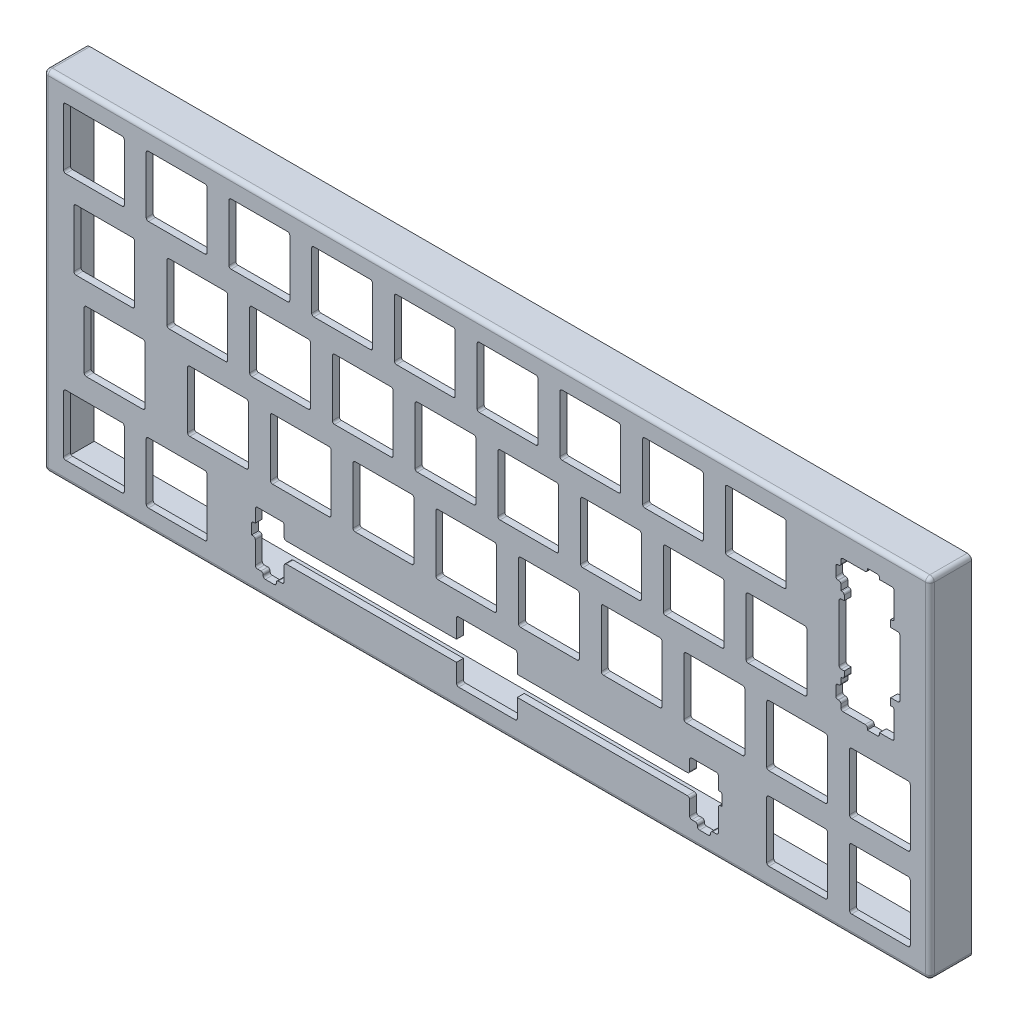
from build123d import *

# Parameters (mm, degrees)
BOSS_EXTRUDE1_OUTLINE_W = 200.025
BOSS_EXTRUDE1_OUTLINE_H = 76.2
BOSS_EXTRUDE1_DEPTH     = 1.6
SKETCH2_W               = 204.025
SKETCH2_H               = 80.2
SKETCH2_W_2             = 200.025
SKETCH2_H_2             = 76.2
BOSS_EXTRUDE2_DEPTH     = 9.6
FILLET1_R               = 1
FILLET2_R               = 1


# Read off the part's stored shape, not the designer's step: Boss-Extrude1
with BuildPart() as part:
    # Boss-Extrude1 outline → Boss-Extrude1 (new body)
    with BuildSketch(Plane.XY):
        with Locations((100.0125, 38.1)):
            Rectangle(BOSS_EXTRUDE1_OUTLINE_W, BOSS_EXTRUDE1_OUTLINE_H)
        with BuildLine():
            Line((16.525, 16.025), (16.525, 3.025))
            ThreePointArc((16.525, 3.025), (16.378553391, 2.671446609), (16.025, 2.525))
            Line((16.025, 2.525), (3.025, 2.525))
            ThreePointArc((3.025, 2.525), (2.671446609, 2.671446609), (2.525, 3.025))
            Line((2.525, 3.025), (2.525, 16.025))
            ThreePointArc((2.525, 16.025), (2.671446609, 16.378553391), (3.025, 16.525))
            Line((3.025, 16.525), (16.025, 16.525))
            ThreePointArc((16.025, 16.525), (16.378553391, 16.378553391), (16.525, 16.025))
        make_face(mode=Mode.SUBTRACT)
        with BuildLine():
            Line((35.575, 16.025), (35.575, 3.025))
            ThreePointArc((35.575, 3.025), (35.428553391, 2.671446609), (35.075, 2.525))
            Line((35.075, 2.525), (22.075, 2.525))
            ThreePointArc((22.075, 2.525), (21.721446609, 2.671446609), (21.575, 3.025))
            Line((21.575, 3.025), (21.575, 16.025))
            ThreePointArc((21.575, 16.025), (21.721446609, 16.378553391), (22.075, 16.525))
            Line((22.075, 16.525), (35.075, 16.525))
            ThreePointArc((35.075, 16.525), (35.428553391, 16.378553391), (35.575, 16.025))
        make_face(mode=Mode.SUBTRACT)
        with BuildLine():
            Line((147.1851, 15.2146), (152.8399, 15.2146))
            ThreePointArc((152.8399, 15.2146), (153.193453391, 15.068153391), (153.3399, 14.7146))
            Line((153.3399, 14.7146), (153.3399, 11.811))
            Line((153.3399, 11.811), (153.7035, 11.811))
            ThreePointArc((153.7035, 11.811), (154.057053391, 11.664553391), (154.2035, 11.311))
            Line((154.2035, 11.311), (154.2035, 9.017))
            Line((154.2035, 9.017), (153.8399, 9.017))
            ThreePointArc((153.8399, 9.017), (153.486346609, 8.870553391), (153.3399, 8.517))
            Line((153.3399, 8.517), (153.3399, 3.421))
            ThreePointArc((153.3399, 3.421), (153.193453391, 3.067446609), (152.8399, 2.921))
            Line((152.8399, 2.921), (152.0365, 2.921))
            ThreePointArc((152.0365, 2.921), (151.682946609, 2.774553391), (151.5365, 2.421))
            Line((151.5365, 2.421), (151.5365, 2.2526))
            ThreePointArc((151.5365, 2.2526), (151.390053391, 1.899046609), (151.0365, 1.7526))
            Line((151.0365, 1.7526), (148.9885, 1.7526))
            ThreePointArc((148.9885, 1.7526), (148.634946609, 1.899046609), (148.4885, 2.2526))
            Line((148.4885, 2.2526), (148.4885, 2.421))
            ThreePointArc((148.4885, 2.421), (148.342053391, 2.774553391), (147.9885, 2.921))
            Line((147.9885, 2.921), (147.1851, 2.921))
            ThreePointArc((147.1851, 2.921), (146.831546609, 3.067446609), (146.6851, 3.421))
            Line((146.6851, 3.421), (146.6851, 6.725))
            ThreePointArc((146.6851, 6.725), (146.538653391, 7.078553391), (146.1851, 7.225))
            Line((146.1851, 7.225), (107.0125, 7.225))
            Line((107.0125, 7.225), (107.0125, 3.025))
            ThreePointArc((107.0125, 3.025), (106.866053391, 2.671446609), (106.5125, 2.525))
            Line((106.5125, 2.525), (93.5125, 2.525))
            ThreePointArc((93.5125, 2.525), (93.158946609, 2.671446609), (93.0125, 3.025))
            Line((93.0125, 3.025), (93.0125, 7.225))
            Line((93.0125, 7.225), (53.8399, 7.225))
            ThreePointArc((53.8399, 7.225), (53.486346609, 7.078553391), (53.3399, 6.725))
            Line((53.3399, 6.725), (53.3399, 3.421))
            ThreePointArc((53.3399, 3.421), (53.193453391, 3.067446609), (52.8399, 2.921))
            Line((52.8399, 2.921), (52.0365, 2.921))
            ThreePointArc((52.0365, 2.921), (51.682946609, 2.774553391), (51.5365, 2.421))
            Line((51.5365, 2.421), (51.5365, 2.2526))
            ThreePointArc((51.5365, 2.2526), (51.390053391, 1.899046609), (51.0365, 1.7526))
            Line((51.0365, 1.7526), (48.9885, 1.7526))
            ThreePointArc((48.9885, 1.7526), (48.634946609, 1.899046609), (48.4885, 2.2526))
            Line((48.4885, 2.2526), (48.4885, 2.421))
            ThreePointArc((48.4885, 2.421), (48.342053391, 2.774553391), (47.9885, 2.921))
            Line((47.9885, 2.921), (47.1851, 2.921))
            ThreePointArc((47.1851, 2.921), (46.831546609, 3.067446609), (46.6851, 3.421))
            Line((46.6851, 3.421), (46.6851, 8.517))
            ThreePointArc((46.6851, 8.517), (46.538653391, 8.870553391), (46.1851, 9.017))
            Line((46.1851, 9.017), (45.8215, 9.017))
            Line((45.8215, 9.017), (45.8215, 11.311))
            ThreePointArc((45.8215, 11.311), (45.967946609, 11.664553391), (46.3215, 11.811))
            Line((46.3215, 11.811), (46.6851, 11.811))
            Line((46.6851, 11.811), (46.6851, 14.7146))
            ThreePointArc((46.6851, 14.7146), (46.831546609, 15.068153391), (47.1851, 15.2146))
            Line((47.1851, 15.2146), (52.8399, 15.2146))
            ThreePointArc((52.8399, 15.2146), (53.193453391, 15.068153391), (53.3399, 14.7146))
            Line((53.3399, 14.7146), (53.3399, 12.325))
            ThreePointArc((53.3399, 12.325), (53.486346609, 11.971446609), (53.8399, 11.825))
            Line((53.8399, 11.825), (93.0125, 11.825))
            Line((93.0125, 11.825), (93.0125, 16.025))
            ThreePointArc((93.0125, 16.025), (93.158946609, 16.378553391), (93.5125, 16.525))
            Line((93.5125, 16.525), (106.5125, 16.525))
            ThreePointArc((106.5125, 16.525), (106.866053391, 16.378553391), (107.0125, 16.025))
            Line((107.0125, 16.025), (107.0125, 11.825))
            Line((107.0125, 11.825), (146.1851, 11.825))
            ThreePointArc((146.1851, 11.825), (146.538653391, 11.971446609), (146.6851, 12.325))
            Line((146.6851, 12.325), (146.6851, 14.7146))
            ThreePointArc((146.6851, 14.7146), (146.831546609, 15.068153391), (147.1851, 15.2146))
        make_face(mode=Mode.SUBTRACT)
        with BuildLine():
            Line((21.2875, 35.075), (21.2875, 22.075))
            ThreePointArc((21.2875, 22.075), (21.141053391, 21.721446609), (20.7875, 21.575))
            Line((20.7875, 21.575), (7.7875, 21.575))
            ThreePointArc((7.7875, 21.575), (7.433946609, 21.721446609), (7.2875, 22.075))
            Line((7.2875, 22.075), (7.2875, 35.075))
            ThreePointArc((7.2875, 35.075), (7.433946609, 35.428553391), (7.7875, 35.575))
            Line((7.7875, 35.575), (20.7875, 35.575))
            ThreePointArc((20.7875, 35.575), (21.141053391, 35.428553391), (21.2875, 35.075))
        make_face(mode=Mode.SUBTRACT)
        with BuildLine():
            Line((45.1, 35.075), (45.1, 22.075))
            ThreePointArc((45.1, 22.075), (44.953553391, 21.721446609), (44.6, 21.575))
            Line((44.6, 21.575), (31.6, 21.575))
            ThreePointArc((31.6, 21.575), (31.246446609, 21.721446609), (31.1, 22.075))
            Line((31.1, 22.075), (31.1, 35.075))
            ThreePointArc((31.1, 35.075), (31.246446609, 35.428553391), (31.6, 35.575))
            Line((31.6, 35.575), (44.6, 35.575))
            ThreePointArc((44.6, 35.575), (44.953553391, 35.428553391), (45.1, 35.075))
        make_face(mode=Mode.SUBTRACT)
        with BuildLine():
            Line((64.15, 35.075), (64.15, 22.075))
            ThreePointArc((64.15, 22.075), (64.003553391, 21.721446609), (63.65, 21.575))
            Line((63.65, 21.575), (50.65, 21.575))
            ThreePointArc((50.65, 21.575), (50.296446609, 21.721446609), (50.15, 22.075))
            Line((50.15, 22.075), (50.15, 35.075))
            ThreePointArc((50.15, 35.075), (50.296446609, 35.428553391), (50.65, 35.575))
            Line((50.65, 35.575), (63.65, 35.575))
            ThreePointArc((63.65, 35.575), (64.003553391, 35.428553391), (64.15, 35.075))
        make_face(mode=Mode.SUBTRACT)
        with BuildLine():
            Line((83.2, 35.075), (83.2, 22.075))
            ThreePointArc((83.2, 22.075), (83.053553391, 21.721446609), (82.7, 21.575))
            Line((82.7, 21.575), (69.7, 21.575))
            ThreePointArc((69.7, 21.575), (69.346446609, 21.721446609), (69.2, 22.075))
            Line((69.2, 22.075), (69.2, 35.075))
            ThreePointArc((69.2, 35.075), (69.346446609, 35.428553391), (69.7, 35.575))
            Line((69.7, 35.575), (82.7, 35.575))
            ThreePointArc((82.7, 35.575), (83.053553391, 35.428553391), (83.2, 35.075))
        make_face(mode=Mode.SUBTRACT)
        with BuildLine():
            Line((102.25, 35.075), (102.25, 22.075))
            ThreePointArc((102.25, 22.075), (102.103553391, 21.721446609), (101.75, 21.575))
            Line((101.75, 21.575), (88.75, 21.575))
            ThreePointArc((88.75, 21.575), (88.396446609, 21.721446609), (88.25, 22.075))
            Line((88.25, 22.075), (88.25, 35.075))
            ThreePointArc((88.25, 35.075), (88.396446609, 35.428553391), (88.75, 35.575))
            Line((88.75, 35.575), (101.75, 35.575))
            ThreePointArc((101.75, 35.575), (102.103553391, 35.428553391), (102.25, 35.075))
        make_face(mode=Mode.SUBTRACT)
        with BuildLine():
            Line((178.45, 16.025), (178.45, 3.025))
            ThreePointArc((178.45, 3.025), (178.303553391, 2.671446609), (177.95, 2.525))
            Line((177.95, 2.525), (164.95, 2.525))
            ThreePointArc((164.95, 2.525), (164.596446609, 2.671446609), (164.45, 3.025))
            Line((164.45, 3.025), (164.45, 16.025))
            ThreePointArc((164.45, 16.025), (164.596446609, 16.378553391), (164.95, 16.525))
            Line((164.95, 16.525), (177.95, 16.525))
            ThreePointArc((177.95, 16.525), (178.303553391, 16.378553391), (178.45, 16.025))
        make_face(mode=Mode.SUBTRACT)
        with BuildLine():
            Line((197.5, 16.025), (197.5, 3.025))
            ThreePointArc((197.5, 3.025), (197.353553391, 2.671446609), (197, 2.525))
            Line((197, 2.525), (184, 2.525))
            ThreePointArc((184, 2.525), (183.646446609, 2.671446609), (183.5, 3.025))
            Line((183.5, 3.025), (183.5, 16.025))
            ThreePointArc((183.5, 16.025), (183.646446609, 16.378553391), (184, 16.525))
            Line((184, 16.525), (197, 16.525))
            ThreePointArc((197, 16.525), (197.353553391, 16.378553391), (197.5, 16.025))
        make_face(mode=Mode.SUBTRACT)
        with BuildLine():
            Line((121.3, 35.075), (121.3, 22.075))
            ThreePointArc((121.3, 22.075), (121.153553391, 21.721446609), (120.8, 21.575))
            Line((120.8, 21.575), (107.8, 21.575))
            ThreePointArc((107.8, 21.575), (107.446446609, 21.721446609), (107.3, 22.075))
            Line((107.3, 22.075), (107.3, 35.075))
            ThreePointArc((107.3, 35.075), (107.446446609, 35.428553391), (107.8, 35.575))
            Line((107.8, 35.575), (120.8, 35.575))
            ThreePointArc((120.8, 35.575), (121.153553391, 35.428553391), (121.3, 35.075))
        make_face(mode=Mode.SUBTRACT)
        with BuildLine():
            Line((140.35, 35.075), (140.35, 22.075))
            ThreePointArc((140.35, 22.075), (140.203553391, 21.721446609), (139.85, 21.575))
            Line((139.85, 21.575), (126.85, 21.575))
            ThreePointArc((126.85, 21.575), (126.496446609, 21.721446609), (126.35, 22.075))
            Line((126.35, 22.075), (126.35, 35.075))
            ThreePointArc((126.35, 35.075), (126.496446609, 35.428553391), (126.85, 35.575))
            Line((126.85, 35.575), (139.85, 35.575))
            ThreePointArc((139.85, 35.575), (140.203553391, 35.428553391), (140.35, 35.075))
        make_face(mode=Mode.SUBTRACT)
        with BuildLine():
            Line((178.45, 35.075), (178.45, 22.075))
            ThreePointArc((178.45, 22.075), (178.303553391, 21.721446609), (177.95, 21.575))
            Line((177.95, 21.575), (164.95, 21.575))
            ThreePointArc((164.95, 21.575), (164.596446609, 21.721446609), (164.45, 22.075))
            Line((164.45, 22.075), (164.45, 35.075))
            ThreePointArc((164.45, 35.075), (164.596446609, 35.428553391), (164.95, 35.575))
            Line((164.95, 35.575), (177.95, 35.575))
            ThreePointArc((177.95, 35.575), (178.303553391, 35.428553391), (178.45, 35.075))
        make_face(mode=Mode.SUBTRACT)
        with BuildLine():
            Line((159.4, 35.075), (159.4, 22.075))
            ThreePointArc((159.4, 22.075), (159.253553391, 21.721446609), (158.9, 21.575))
            Line((158.9, 21.575), (145.9, 21.575))
            ThreePointArc((145.9, 21.575), (145.546446609, 21.721446609), (145.4, 22.075))
            Line((145.4, 22.075), (145.4, 35.075))
            ThreePointArc((145.4, 35.075), (145.546446609, 35.428553391), (145.9, 35.575))
            Line((145.9, 35.575), (158.9, 35.575))
            ThreePointArc((158.9, 35.575), (159.253553391, 35.428553391), (159.4, 35.075))
        make_face(mode=Mode.SUBTRACT)
        with BuildLine():
            Line((197.5, 35.075), (197.5, 22.075))
            ThreePointArc((197.5, 22.075), (197.353553391, 21.721446609), (197, 21.575))
            Line((197, 21.575), (184, 21.575))
            ThreePointArc((184, 21.575), (183.646446609, 21.721446609), (183.5, 22.075))
            Line((183.5, 22.075), (183.5, 35.075))
            ThreePointArc((183.5, 35.075), (183.646446609, 35.428553391), (184, 35.575))
            Line((184, 35.575), (197, 35.575))
            ThreePointArc((197, 35.575), (197.353553391, 35.428553391), (197.5, 35.075))
        make_face(mode=Mode.SUBTRACT)
        with BuildLine():
            Line((18.90625, 54.125), (18.90625, 41.125))
            ThreePointArc((18.90625, 41.125), (18.759803391, 40.771446609), (18.40625, 40.625))
            Line((18.40625, 40.625), (5.40625, 40.625))
            ThreePointArc((5.40625, 40.625), (5.052696609, 40.771446609), (4.90625, 41.125))
            Line((4.90625, 41.125), (4.90625, 54.125))
            ThreePointArc((4.90625, 54.125), (5.052696609, 54.478553391), (5.40625, 54.625))
            Line((5.40625, 54.625), (18.40625, 54.625))
            ThreePointArc((18.40625, 54.625), (18.759803391, 54.478553391), (18.90625, 54.125))
        make_face(mode=Mode.SUBTRACT)
        with BuildLine():
            Line((40.3375, 54.125), (40.3375, 41.125))
            ThreePointArc((40.3375, 41.125), (40.191053391, 40.771446609), (39.8375, 40.625))
            Line((39.8375, 40.625), (26.8375, 40.625))
            ThreePointArc((26.8375, 40.625), (26.483946609, 40.771446609), (26.3375, 41.125))
            Line((26.3375, 41.125), (26.3375, 54.125))
            ThreePointArc((26.3375, 54.125), (26.483946609, 54.478553391), (26.8375, 54.625))
            Line((26.8375, 54.625), (39.8375, 54.625))
            ThreePointArc((39.8375, 54.625), (40.191053391, 54.478553391), (40.3375, 54.125))
        make_face(mode=Mode.SUBTRACT)
        with BuildLine():
            Line((59.3875, 54.125), (59.3875, 41.125))
            ThreePointArc((59.3875, 41.125), (59.241053391, 40.771446609), (58.8875, 40.625))
            Line((58.8875, 40.625), (45.8875, 40.625))
            ThreePointArc((45.8875, 40.625), (45.533946609, 40.771446609), (45.3875, 41.125))
            Line((45.3875, 41.125), (45.3875, 54.125))
            ThreePointArc((45.3875, 54.125), (45.533946609, 54.478553391), (45.8875, 54.625))
            Line((45.8875, 54.625), (58.8875, 54.625))
            ThreePointArc((58.8875, 54.625), (59.241053391, 54.478553391), (59.3875, 54.125))
        make_face(mode=Mode.SUBTRACT)
        with BuildLine():
            Line((78.4375, 54.125), (78.4375, 41.125))
            ThreePointArc((78.4375, 41.125), (78.291053391, 40.771446609), (77.9375, 40.625))
            Line((77.9375, 40.625), (64.9375, 40.625))
            ThreePointArc((64.9375, 40.625), (64.583946609, 40.771446609), (64.4375, 41.125))
            Line((64.4375, 41.125), (64.4375, 54.125))
            ThreePointArc((64.4375, 54.125), (64.583946609, 54.478553391), (64.9375, 54.625))
            Line((64.9375, 54.625), (77.9375, 54.625))
            ThreePointArc((77.9375, 54.625), (78.291053391, 54.478553391), (78.4375, 54.125))
        make_face(mode=Mode.SUBTRACT)
        with BuildLine():
            Line((97.4875, 54.125), (97.4875, 41.125))
            ThreePointArc((97.4875, 41.125), (97.341053391, 40.771446609), (96.9875, 40.625))
            Line((96.9875, 40.625), (83.9875, 40.625))
            ThreePointArc((83.9875, 40.625), (83.633946609, 40.771446609), (83.4875, 41.125))
            Line((83.4875, 41.125), (83.4875, 54.125))
            ThreePointArc((83.4875, 54.125), (83.633946609, 54.478553391), (83.9875, 54.625))
            Line((83.9875, 54.625), (96.9875, 54.625))
            ThreePointArc((96.9875, 54.625), (97.341053391, 54.478553391), (97.4875, 54.125))
        make_face(mode=Mode.SUBTRACT)
        with BuildLine():
            Line((16.525, 73.175), (16.525, 60.175))
            ThreePointArc((16.525, 60.175), (16.378553391, 59.821446609), (16.025, 59.675))
            Line((16.025, 59.675), (3.025, 59.675))
            ThreePointArc((3.025, 59.675), (2.671446609, 59.821446609), (2.525, 60.175))
            Line((2.525, 60.175), (2.525, 73.175))
            ThreePointArc((2.525, 73.175), (2.671446609, 73.528553391), (3.025, 73.675))
            Line((3.025, 73.675), (16.025, 73.675))
            ThreePointArc((16.025, 73.675), (16.378553391, 73.528553391), (16.525, 73.175))
        make_face(mode=Mode.SUBTRACT)
        with BuildLine():
            Line((35.575, 73.175), (35.575, 60.175))
            ThreePointArc((35.575, 60.175), (35.428553391, 59.821446609), (35.075, 59.675))
            Line((35.075, 59.675), (22.075, 59.675))
            ThreePointArc((22.075, 59.675), (21.721446609, 59.821446609), (21.575, 60.175))
            Line((21.575, 60.175), (21.575, 73.175))
            ThreePointArc((21.575, 73.175), (21.721446609, 73.528553391), (22.075, 73.675))
            Line((22.075, 73.675), (35.075, 73.675))
            ThreePointArc((35.075, 73.675), (35.428553391, 73.528553391), (35.575, 73.175))
        make_face(mode=Mode.SUBTRACT)
        with BuildLine():
            Line((54.625, 73.175), (54.625, 60.175))
            ThreePointArc((54.625, 60.175), (54.478553391, 59.821446609), (54.125, 59.675))
            Line((54.125, 59.675), (41.125, 59.675))
            ThreePointArc((41.125, 59.675), (40.771446609, 59.821446609), (40.625, 60.175))
            Line((40.625, 60.175), (40.625, 73.175))
            ThreePointArc((40.625, 73.175), (40.771446609, 73.528553391), (41.125, 73.675))
            Line((41.125, 73.675), (54.125, 73.675))
            ThreePointArc((54.125, 73.675), (54.478553391, 73.528553391), (54.625, 73.175))
        make_face(mode=Mode.SUBTRACT)
        with BuildLine():
            Line((73.675, 73.175), (73.675, 60.175))
            ThreePointArc((73.675, 60.175), (73.528553391, 59.821446609), (73.175, 59.675))
            Line((73.175, 59.675), (60.175, 59.675))
            ThreePointArc((60.175, 59.675), (59.821446609, 59.821446609), (59.675, 60.175))
            Line((59.675, 60.175), (59.675, 73.175))
            ThreePointArc((59.675, 73.175), (59.821446609, 73.528553391), (60.175, 73.675))
            Line((60.175, 73.675), (73.175, 73.675))
            ThreePointArc((73.175, 73.675), (73.528553391, 73.528553391), (73.675, 73.175))
        make_face(mode=Mode.SUBTRACT)
        with BuildLine():
            Line((92.725, 73.175), (92.725, 60.175))
            ThreePointArc((92.725, 60.175), (92.578553391, 59.821446609), (92.225, 59.675))
            Line((92.225, 59.675), (79.225, 59.675))
            ThreePointArc((79.225, 59.675), (78.871446609, 59.821446609), (78.725, 60.175))
            Line((78.725, 60.175), (78.725, 73.175))
            ThreePointArc((78.725, 73.175), (78.871446609, 73.528553391), (79.225, 73.675))
            Line((79.225, 73.675), (92.225, 73.675))
            ThreePointArc((92.225, 73.675), (92.578553391, 73.528553391), (92.725, 73.175))
        make_face(mode=Mode.SUBTRACT)
        with BuildLine():
            Line((116.5375, 54.125), (116.5375, 41.125))
            ThreePointArc((116.5375, 41.125), (116.391053391, 40.771446609), (116.0375, 40.625))
            Line((116.0375, 40.625), (103.0375, 40.625))
            ThreePointArc((103.0375, 40.625), (102.683946609, 40.771446609), (102.5375, 41.125))
            Line((102.5375, 41.125), (102.5375, 54.125))
            ThreePointArc((102.5375, 54.125), (102.683946609, 54.478553391), (103.0375, 54.625))
            Line((103.0375, 54.625), (116.0375, 54.625))
            ThreePointArc((116.0375, 54.625), (116.391053391, 54.478553391), (116.5375, 54.125))
        make_face(mode=Mode.SUBTRACT)
        with BuildLine():
            Line((135.5875, 54.125), (135.5875, 41.125))
            ThreePointArc((135.5875, 41.125), (135.441053391, 40.771446609), (135.0875, 40.625))
            Line((135.0875, 40.625), (122.0875, 40.625))
            ThreePointArc((122.0875, 40.625), (121.733946609, 40.771446609), (121.5875, 41.125))
            Line((121.5875, 41.125), (121.5875, 54.125))
            ThreePointArc((121.5875, 54.125), (121.733946609, 54.478553391), (122.0875, 54.625))
            Line((122.0875, 54.625), (135.0875, 54.625))
            ThreePointArc((135.0875, 54.625), (135.441053391, 54.478553391), (135.5875, 54.125))
        make_face(mode=Mode.SUBTRACT)
        with BuildLine():
            Line((154.6375, 54.125), (154.6375, 41.125))
            ThreePointArc((154.6375, 41.125), (154.491053391, 40.771446609), (154.1375, 40.625))
            Line((154.1375, 40.625), (141.1375, 40.625))
            ThreePointArc((141.1375, 40.625), (140.783946609, 40.771446609), (140.6375, 41.125))
            Line((140.6375, 41.125), (140.6375, 54.125))
            ThreePointArc((140.6375, 54.125), (140.783946609, 54.478553391), (141.1375, 54.625))
            Line((141.1375, 54.625), (154.1375, 54.625))
            ThreePointArc((154.1375, 54.625), (154.491053391, 54.478553391), (154.6375, 54.125))
        make_face(mode=Mode.SUBTRACT)
        with BuildLine():
            Line((173.6875, 54.125), (173.6875, 41.125))
            ThreePointArc((173.6875, 41.125), (173.541053391, 40.771446609), (173.1875, 40.625))
            Line((173.1875, 40.625), (160.1875, 40.625))
            ThreePointArc((160.1875, 40.625), (159.833946609, 40.771446609), (159.6875, 41.125))
            Line((159.6875, 41.125), (159.6875, 54.125))
            ThreePointArc((159.6875, 54.125), (159.833946609, 54.478553391), (160.1875, 54.625))
            Line((160.1875, 54.625), (173.1875, 54.625))
            ThreePointArc((173.1875, 54.625), (173.541053391, 54.478553391), (173.6875, 54.125))
        make_face(mode=Mode.SUBTRACT)
        with BuildLine():
            Line((111.775, 73.175), (111.775, 60.175))
            ThreePointArc((111.775, 60.175), (111.628553391, 59.821446609), (111.275, 59.675))
            Line((111.275, 59.675), (98.275, 59.675))
            ThreePointArc((98.275, 59.675), (97.921446609, 59.821446609), (97.775, 60.175))
            Line((97.775, 60.175), (97.775, 73.175))
            ThreePointArc((97.775, 73.175), (97.921446609, 73.528553391), (98.275, 73.675))
            Line((98.275, 73.675), (111.275, 73.675))
            ThreePointArc((111.275, 73.675), (111.628553391, 73.528553391), (111.775, 73.175))
        make_face(mode=Mode.SUBTRACT)
        with BuildLine():
            Line((130.825, 73.175), (130.825, 60.175))
            ThreePointArc((130.825, 60.175), (130.678553391, 59.821446609), (130.325, 59.675))
            Line((130.325, 59.675), (117.325, 59.675))
            ThreePointArc((117.325, 59.675), (116.971446609, 59.821446609), (116.825, 60.175))
            Line((116.825, 60.175), (116.825, 73.175))
            ThreePointArc((116.825, 73.175), (116.971446609, 73.528553391), (117.325, 73.675))
            Line((117.325, 73.675), (130.325, 73.675))
            ThreePointArc((130.325, 73.675), (130.678553391, 73.528553391), (130.825, 73.175))
        make_face(mode=Mode.SUBTRACT)
        with BuildLine():
            Line((149.875, 73.175), (149.875, 60.175))
            ThreePointArc((149.875, 60.175), (149.728553391, 59.821446609), (149.375, 59.675))
            Line((149.375, 59.675), (136.375, 59.675))
            ThreePointArc((136.375, 59.675), (136.021446609, 59.821446609), (135.875, 60.175))
            Line((135.875, 60.175), (135.875, 73.175))
            ThreePointArc((135.875, 73.175), (136.021446609, 73.528553391), (136.375, 73.675))
            Line((136.375, 73.675), (149.375, 73.675))
            ThreePointArc((149.375, 73.675), (149.728553391, 73.528553391), (149.875, 73.175))
        make_face(mode=Mode.SUBTRACT)
        with BuildLine():
            Line((193.80835, 48.0394), (193.80835, 42.3846))
            ThreePointArc((193.80835, 42.3846), (193.661903391, 42.031046609), (193.30835, 41.8846))
            Line((193.30835, 41.8846), (190.40475, 41.8846))
            Line((190.40475, 41.8846), (190.40475, 41.521))
            ThreePointArc((190.40475, 41.521), (190.258303391, 41.167446609), (189.90475, 41.021))
            Line((189.90475, 41.021), (187.61075, 41.021))
            Line((187.61075, 41.021), (187.61075, 41.3846))
            ThreePointArc((187.61075, 41.3846), (187.464303391, 41.738153391), (187.11075, 41.8846))
            Line((187.11075, 41.8846), (182.01475, 41.8846))
            ThreePointArc((182.01475, 41.8846), (181.661196609, 42.031046609), (181.51475, 42.3846))
            Line((181.51475, 42.3846), (181.51475, 43.188))
            ThreePointArc((181.51475, 43.188), (181.368303391, 43.541553391), (181.01475, 43.688))
            Line((181.01475, 43.688), (180.84635, 43.688))
            ThreePointArc((180.84635, 43.688), (180.492796609, 43.834446609), (180.34635, 44.188))
            Line((180.34635, 44.188), (180.34635, 46.236))
            ThreePointArc((180.34635, 46.236), (180.492796609, 46.589553391), (180.84635, 46.736))
            Line((180.84635, 46.736), (181.01475, 46.736))
            ThreePointArc((181.01475, 46.736), (181.368303391, 46.882446609), (181.51475, 47.236))
            Line((181.51475, 47.236), (181.51475, 48.5394))
            Line((181.51475, 48.5394), (181.80215, 48.5394))
            ThreePointArc((181.80215, 48.5394), (182.155703391, 48.685846609), (182.30215, 49.0394))
            Line((182.30215, 49.0394), (182.30215, 50.15))
            Line((182.30215, 50.15), (181.61875, 50.15))
            ThreePointArc((181.61875, 50.15), (181.265196609, 50.296446609), (181.11875, 50.65))
            Line((181.11875, 50.65), (181.11875, 63.65))
            ThreePointArc((181.11875, 63.65), (181.265196609, 64.003553391), (181.61875, 64.15))
            Line((181.61875, 64.15), (182.30215, 64.15))
            Line((182.30215, 64.15), (182.30215, 65.2606))
            ThreePointArc((182.30215, 65.2606), (182.155703391, 65.614153391), (181.80215, 65.7606))
            Line((181.80215, 65.7606), (181.51475, 65.7606))
            Line((181.51475, 65.7606), (181.51475, 67.064))
            ThreePointArc((181.51475, 67.064), (181.368303391, 67.417553391), (181.01475, 67.564))
            Line((181.01475, 67.564), (180.84635, 67.564))
            ThreePointArc((180.84635, 67.564), (180.492796609, 67.710446609), (180.34635, 68.064))
            Line((180.34635, 68.064), (180.34635, 70.112))
            ThreePointArc((180.34635, 70.112), (180.492796609, 70.465553391), (180.84635, 70.612))
            Line((180.84635, 70.612), (181.01475, 70.612))
            ThreePointArc((181.01475, 70.612), (181.368303391, 70.758446609), (181.51475, 71.112))
            Line((181.51475, 71.112), (181.51475, 71.9154))
            ThreePointArc((181.51475, 71.9154), (181.661196609, 72.268953391), (182.01475, 72.4154))
            Line((182.01475, 72.4154), (187.11075, 72.4154))
            ThreePointArc((187.11075, 72.4154), (187.464303391, 72.561846609), (187.61075, 72.9154))
            Line((187.61075, 72.9154), (187.61075, 73.279))
            Line((187.61075, 73.279), (189.90475, 73.279))
            ThreePointArc((189.90475, 73.279), (190.258303391, 73.132553391), (190.40475, 72.779))
            Line((190.40475, 72.779), (190.40475, 72.4154))
            Line((190.40475, 72.4154), (193.30835, 72.4154))
            ThreePointArc((193.30835, 72.4154), (193.661903391, 72.268953391), (193.80835, 71.9154))
            Line((193.80835, 71.9154), (193.80835, 66.2606))
            ThreePointArc((193.80835, 66.2606), (193.661903391, 65.907046609), (193.30835, 65.7606))
            Line((193.30835, 65.7606), (192.99555, 65.7606))
            Line((192.99555, 65.7606), (192.99555, 64.15))
            Line((192.99555, 64.15), (194.61875, 64.15))
            ThreePointArc((194.61875, 64.15), (194.972303391, 64.003553391), (195.11875, 63.65))
            Line((195.11875, 63.65), (195.11875, 50.65))
            ThreePointArc((195.11875, 50.65), (194.972303391, 50.296446609), (194.61875, 50.15))
            Line((194.61875, 50.15), (192.99555, 50.15))
            Line((192.99555, 50.15), (192.99555, 48.5394))
            Line((192.99555, 48.5394), (193.30835, 48.5394))
            ThreePointArc((193.30835, 48.5394), (193.661903391, 48.392953391), (193.80835, 48.0394))
        make_face(mode=Mode.SUBTRACT)
        with BuildLine():
            Line((168.925, 73.175), (168.925, 60.175))
            ThreePointArc((168.925, 60.175), (168.778553391, 59.821446609), (168.425, 59.675))
            Line((168.425, 59.675), (155.425, 59.675))
            ThreePointArc((155.425, 59.675), (155.071446609, 59.821446609), (154.925, 60.175))
            Line((154.925, 60.175), (154.925, 73.175))
            ThreePointArc((154.925, 73.175), (155.071446609, 73.528553391), (155.425, 73.675))
            Line((155.425, 73.675), (168.425, 73.675))
            ThreePointArc((168.425, 73.675), (168.778553391, 73.528553391), (168.925, 73.175))
        make_face(mode=Mode.SUBTRACT)
    extrude(amount=BOSS_EXTRUDE1_DEPTH)

    # Sketch2 → Boss-Extrude2 (add)
    with BuildSketch(Plane.XY.offset(1.6)):
        with Locations((100.0125, 38.1)):
            Rectangle(SKETCH2_W, SKETCH2_H)
        with Locations((100.0125, 38.1)):
            Rectangle(SKETCH2_W_2, SKETCH2_H_2, mode=Mode.SUBTRACT)
    extrude(amount=-BOSS_EXTRUDE2_DEPTH)

    # Fillet1
    fillet1_edges = [part.edges().sort_by_distance(p)[0] for p in [
        (-2, 38.1, 1.6),
        (100.0125, 78.2, 1.6),
        (202.025, 38.1, 1.6),
        (100.0125, -2, 1.6),
    ]]
    fillet(fillet1_edges, radius=FILLET1_R)

    # Fillet2
    # the kernel refuses this fillet: 1 mm, written as the material it takes off along each edge
    with BuildSketch(Plane(origin=(-1, -1, 0.6), x_dir=(0, -1, 0), z_dir=(-1, 0, 0))) as fillet2_piece_1_section:
        Polygon((0, 0), (FILLET2_R, 0), (FILLET2_R, FILLET2_R), (0, FILLET2_R), align=None)
    fillet2_piece_1 = extrude(amount=FILLET2_R, mode=Mode.PRIVATE)
    fillet2_piece_1 = fillet2_piece_1 - Plane(origin=(-1, -1, 0.6), x_dir=(0, 0.7071067811865475, -0.7071067811865475), z_dir=(-1, 0, 0)) * Sphere(FILLET2_R, mode=Mode.PRIVATE)
    add(fillet2_piece_1, mode=Mode.SUBTRACT)
    with BuildSketch(Plane(origin=(201.025, -1, 0.6), x_dir=(1, 0, 0), z_dir=(0, -1, 0))) as fillet2_piece_2_section:
        Polygon((0, 0), (FILLET2_R, 0), (FILLET2_R, FILLET2_R), (0, FILLET2_R), align=None)
    fillet2_piece_2 = extrude(amount=FILLET2_R, mode=Mode.PRIVATE)
    fillet2_piece_2 = fillet2_piece_2 - Plane(origin=(201.025, -1, 0.6), x_dir=(-0.7071067811865475, 0, -0.7071067811865475), z_dir=(0, -1, 0)) * Sphere(FILLET2_R, mode=Mode.PRIVATE)
    add(fillet2_piece_2, mode=Mode.SUBTRACT)
    with BuildSketch(Plane(origin=(-1, 77.2, 0.6), x_dir=(0, 1, 0), z_dir=(-1, 0, 0))) as fillet2_piece_3_section:
        Polygon((0, 0), (FILLET2_R, 0), (FILLET2_R, -FILLET2_R), (0, -FILLET2_R), align=None)
    fillet2_piece_3 = extrude(amount=FILLET2_R, mode=Mode.PRIVATE)
    fillet2_piece_3 = fillet2_piece_3 - Plane(origin=(-1, 77.2, 0.6), x_dir=(0, -0.7071067811865475, -0.7071067811865475), z_dir=(-1, 0, 0)) * Sphere(FILLET2_R, mode=Mode.PRIVATE)
    add(fillet2_piece_3, mode=Mode.SUBTRACT)
    with BuildSketch(Plane(origin=(201.025, 77.2, 0.6), x_dir=(1, 0, 0), z_dir=(0, 1, 0))) as fillet2_piece_4_section:
        Polygon((0, 0), (FILLET2_R, 0), (FILLET2_R, -FILLET2_R), (0, -FILLET2_R), align=None)
    fillet2_piece_4 = extrude(amount=FILLET2_R, mode=Mode.PRIVATE)
    fillet2_piece_4 = fillet2_piece_4 - Plane(origin=(201.025, 77.2, 0.6), x_dir=(-0.7071067811865475, 0, -0.7071067811865475), z_dir=(0, 1, 0)) * Sphere(FILLET2_R, mode=Mode.PRIVATE)
    add(fillet2_piece_4, mode=Mode.SUBTRACT)
    with BuildSketch(Plane(origin=(-2, -2, 0.6), x_dir=(0, 1, 0), z_dir=(0, 0, -1)), Plane(origin=(202.025, -2, 0.6), x_dir=(-1, 0, 0), z_dir=(0, 0, -1))) as fillet2_piece_5:
        with BuildLine():
            CenterArc((FILLET2_R, FILLET2_R), FILLET2_R, 180, 90)
            Line((0, FILLET2_R), (0, 0))
            Line((0, 0), (FILLET2_R, 0))
        make_face()
    extrude(amount=11.1, mode=Mode.SUBTRACT)
    with BuildSketch(Plane(origin=(-2, 78.2, 0.6), x_dir=(0, -1, 0), z_dir=(0, 0, -1)), Plane(origin=(202.025, 78.2, 0.6), x_dir=(-1, 0, 0), z_dir=(0, 0, -1))) as fillet2_piece_6:
        with BuildLine():
            CenterArc((FILLET2_R, -FILLET2_R), FILLET2_R, 90, 90)
            Line((0, -FILLET2_R), (0, 0))
            Line((0, 0), (FILLET2_R, 0))
        make_face()
    extrude(amount=11.1, mode=Mode.SUBTRACT)


solid = part.part
